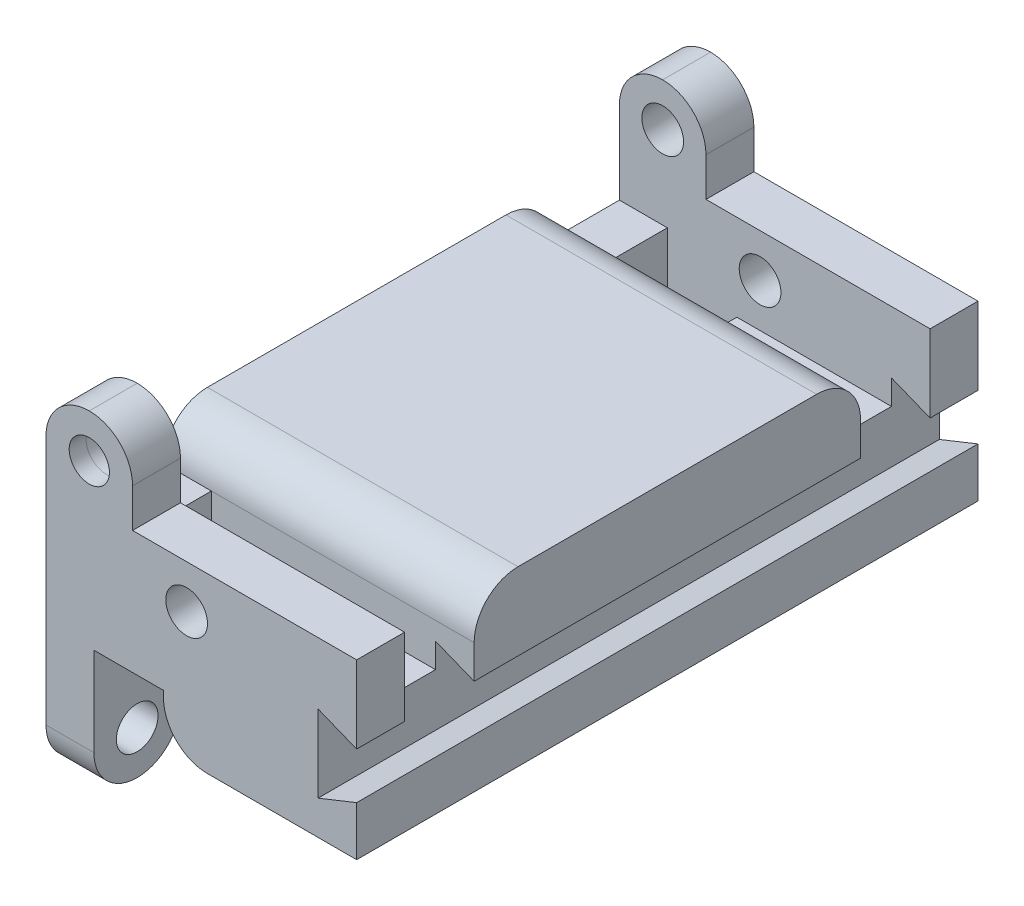
from build123d import *

# Parameters (mm, degrees)
ESBO_O1_R                  = 1.35
RESSALTO_EXTRUS_O1_DEPTH   = 2
ESBO_O3_W                  = 40.2
ESBO_O3_H                  = 2
RESSALTO_EXTRUS_O2_DEPTH   = 10.08
ESBO_O4_W                  = 3.1
ESBO_O4_H                  = 12.84
RESSALTO_EXTRUS_O3_DEPTH   = 34
CORTE_EXTRUS_O1_DEPTH      = 55.735280213
CORTE_EXTRUS_O1_DEPTH_BACK = 55.735280213
ESBO_O5_R                  = 1.35
ESBO_O7_W                  = 37.1
ESBO_O7_H                  = 3.24
CORTE_EXTRUS_O2_DEPTH      = 2
RESSALTO_EXTRUS_O5_START   = 2
ESBO_O12_R                 = 1.35
RESSALTO_EXTRUS_O5_DEPTH   = 2
ESBO_O18_W                 = 3.1
ESBO_O18_H                 = 3.24
RESSALTO_EXTRUS_O6_DEPTH   = 2
ESBO_O19_W                 = 3.1
ESBO_O19_H                 = 3.24
RESSALTO_EXTRUS_O7_DEPTH   = 2
ESBO_O21_R                 = 1.301764144
ESBO_O21_R_2               = 1.35
RESSALTO_EXTRUS_O8_DEPTH   = 1.1
RESSALTO_EXTRUS_O9_START   = 1.1
ESBO_O22_R                 = 1.35
RESSALTO_EXTRUS_O9_DEPTH   = 1.1
ESBO_O23_W                 = 3.1
ESBO_O23_H                 = 5.6
RESSALTO_EXTRUS_O10_DEPTH  = 5.85
CORTE_EXTRUS_O3_REACH      = 63.173
ESBO_O24_R                 = 1.35
ESBO_O25_W                 = 4.5
ESBO_O25_H                 = 3.1
CORTE_EXTRUS_O6_DEPTH      = 4.48
ESBO_O27_W                 = 3.1
ESBO_O27_H                 = 29
CORTE_EXTRUS_O7_DEPTH      = 4.48
ESBO_O28_W                 = 25
ESBO_O28_H                 = 40.2
CORTE_EXTRUS_O8_DEPTH      = 1.24
ESBO_O29_W                 = 25
ESBO_O29_H                 = 5.6
RESSALTO_EXTRUS_O11_DEPTH  = 34
ESBO_O31_W                 = 3.1
ESBO_O31_H                 = 25
RESSALTO_EXTRUS_O12_DEPTH  = 2.84
ESBO_O32_W                 = 25
ESBO_O32_H                 = 5.6
RESSALTO_EXTRUS_O13_DEPTH  = 34
FILETE1_R                  = 2.84
ESBO_O33_W                 = 5.6
ESBO_O33_H                 = 3.1
CORTE_EXTRUS_O9_DEPTH      = 0.55
ESBO_O35_W                 = 3.1
ESBO_O35_H                 = 5.6
CORTE_EXTRUS_O10_DEPTH     = 5.03
FILETE2_R                  = 2.8
DIVIDIR1_SURFACE_1_BACK    = 61.888
DIVIDIR1_SURFACE_1_DEPTH   = 123.776
DIVIDIR1_SURFACE_2_BACK    = 61.888
DIVIDIR1_SURFACE_2_DEPTH   = 123.776


with BuildPart() as part:
    # Esboço1 → Ressalto-extrusão1 (new body)
    with BuildSketch(Plane.XY):
        Polygon((0, 0), (5.6, 0), (5.6, -5.85), (34.6, -5.85), (34.6, 0), (40.2, 0), (40.2, -11.45), (0, -11.45), align=None)
        with Locations((2.8, -3.35)):
            Circle(ESBO_O1_R, mode=Mode.SUBTRACT)
        with Locations((37.4, -3.35)):
            Circle(ESBO_O1_R, mode=Mode.SUBTRACT)
        with Locations((31.1, -8.65)):
            Circle(ESBO_O1_R, mode=Mode.SUBTRACT)
        with Locations((9.1, -8.65)):
            Circle(ESBO_O1_R, mode=Mode.SUBTRACT)
    extrude(amount=RESSALTO_EXTRUS_O1_DEPTH)

    # Esboço3 → Ressalto-extrusão2 (add)
    with BuildSketch(Plane.XZ.offset(11.45)):
        with Locations((20.1, 1)):
            Rectangle(ESBO_O3_W, ESBO_O3_H)
    extrude(amount=RESSALTO_EXTRUS_O2_DEPTH)

    # Esboço4 → Ressalto-extrusão3 (add)
    with BuildSketch(Plane(origin=(0, 0, 0), x_dir=(-1, 0, 0), z_dir=(0, 0, -1))):
        with Locations((-38.65, -15.11)):
            Rectangle(ESBO_O4_W, ESBO_O4_H)
        with Locations((-1.55, -15.11)):
            Rectangle(ESBO_O4_W, ESBO_O4_H)
    extrude(amount=RESSALTO_EXTRUS_O3_DEPTH)

    # Esboço5 → Corte-extrusão1 (cut, two sides: drawn at the far end of the back side and taken through both)
    with BuildSketch(Plane.ZY.offset(-37.1).offset(-CORTE_EXTRUS_O1_DEPTH_BACK)):
        with Locations((-6, -14.25)):
            Circle(ESBO_O5_R)
        with Locations((-28, -14.25)):
            Circle(ESBO_O5_R)
    extrude(amount=CORTE_EXTRUS_O1_DEPTH + CORTE_EXTRUS_O1_DEPTH_BACK, mode=Mode.SUBTRACT)

    # Esboço7 → Corte-extrusão2 (cut)
    with BuildSketch(Plane(origin=(0, 0, 0), x_dir=(-1, 0, 0), z_dir=(0, 0, -1))):
        with Locations((-18.55, -19.91)):
            Rectangle(ESBO_O7_W, ESBO_O7_H)
    extrude(amount=-CORTE_EXTRUS_O2_DEPTH, mode=Mode.SUBTRACT)

    # Esboço12 → Ressalto-extrusão5 (add)
    with BuildSketch(Plane(origin=(0, 0, -34), x_dir=(-1, 0, 0), z_dir=(0, 0, -1)).offset(RESSALTO_EXTRUS_O5_START)):
        Polygon((-5.6, 0), (0, 0), (0, -18.29), (-40.2, -18.29), (-40.2, 0), (-34.6, 0), (-34.6, -5.85), (-5.6, -5.85), align=None)
        with Locations(Location((-31.1, -8.65, 0), (0, 0, 180))):
            Circle(ESBO_O12_R, mode=Mode.SUBTRACT)
        with Locations(Location((-9.1, -8.65, 0), (0, 0, 180))):
            Circle(ESBO_O12_R, mode=Mode.SUBTRACT)
        with Locations(Location((-2.8, -3.35, 0), (0, 0, 180))):
            Circle(ESBO_O12_R, mode=Mode.SUBTRACT)
        with Locations(Location((-37.4, -3.35, 0), (0, 0, 180))):
            Circle(ESBO_O12_R, mode=Mode.SUBTRACT)
    extrude(amount=-RESSALTO_EXTRUS_O5_DEPTH)

    # Esboço18 → Ressalto-extrusão6 (add)
    with BuildSketch(Plane.XY):
        with Locations((1.55, -19.91)):
            Rectangle(ESBO_O18_W, ESBO_O18_H)
    extrude(amount=RESSALTO_EXTRUS_O6_DEPTH)

    # Esboço19 → Ressalto-extrusão7 (add)
    with BuildSketch(Plane(origin=(0, 0, -34), x_dir=(-1, 0, 0), z_dir=(0, 0, -1))):
        with Locations((-1.55, -19.91)):
            Rectangle(ESBO_O19_W, ESBO_O19_H)
        with Locations((-38.65, -19.91)):
            Rectangle(ESBO_O19_W, ESBO_O19_H)
    extrude(amount=RESSALTO_EXTRUS_O7_DEPTH)

    # Esboço21 → Ressalto-extrusão8 (add)
    with BuildSketch(Plane.XY.offset(2)):
        Polygon((37.1, -21.53), (40.2, -21.53), (40.2, 0), (34.6, 0), (34.6, -5.85), (5.6, -5.85), (5.6, 0), (0, 0), (0, -21.53), (3.1, -21.53), (3.1, -18.29), (37.1, -18.29), align=None)
        with Locations((2.8, -3.35)):
            Circle(ESBO_O21_R, mode=Mode.SUBTRACT)
        with Locations((9.1, -8.65)):
            Circle(ESBO_O21_R_2, mode=Mode.SUBTRACT)
        with Locations((31.1, -8.65)):
            Circle(ESBO_O21_R_2, mode=Mode.SUBTRACT)
        with Locations((37.4, -3.35)):
            Circle(ESBO_O21_R_2, mode=Mode.SUBTRACT)
    extrude(amount=RESSALTO_EXTRUS_O8_DEPTH)

    # Esboço22 → Ressalto-extrusão9 (add)
    with BuildSketch(Plane(origin=(0, 0, -36), x_dir=(-1, 0, 0), z_dir=(0, 0, -1)).offset(RESSALTO_EXTRUS_O9_START)):
        Polygon((-5.6, 0), (0, 0), (0, -21.53), (-3.1, -21.53), (-3.1, -18.29), (-37.1, -18.29), (-37.1, -21.53), (-40.2, -21.53), (-40.2, 0), (-34.6, 0), (-34.6, -5.85), (-5.6, -5.85), align=None)
        with Locations(Location((-37.4, -3.35, 0), (0, 0, 180))):
            Circle(ESBO_O22_R, mode=Mode.SUBTRACT)
        with Locations(Location((-31.1, -8.65, 0), (0, 0, 180))):
            Circle(ESBO_O22_R, mode=Mode.SUBTRACT)
        with Locations(Location((-9.1, -8.65, 0), (0, 0, 180))):
            Circle(ESBO_O22_R, mode=Mode.SUBTRACT)
        with Locations(Location((-2.8, -3.35, 0), (0, 0, 180))):
            Circle(ESBO_O22_R, mode=Mode.SUBTRACT)
    extrude(amount=-RESSALTO_EXTRUS_O9_DEPTH)

    # Esboço23 → Ressalto-extrusão10 (add)
    with BuildSketch(Plane.XZ.offset(21.53)):
        with Locations((1.55, 0.3)):
            Rectangle(ESBO_O23_W, ESBO_O23_H)
        with Locations((1.55, -34.3)):
            Rectangle(ESBO_O23_W, ESBO_O23_H)
        with Locations((38.65, -34.3)):
            Rectangle(ESBO_O23_W, ESBO_O23_H)
        with Locations((38.65, 0.3)):
            Rectangle(ESBO_O23_W, ESBO_O23_H)
    extrude(amount=RESSALTO_EXTRUS_O10_DEPTH)

    # Corte-extrusão3: up to this face of the body (flat: up to its plane)
    corte_extrus_o3_end = Plane(part.part.faces().sort_by_distance((40.2, -15.177512698, -17))[0])
    # Esboço24 → Corte-extrusão3 (cut, up to the picked face)
    with BuildSketch(Plane.ZY, mode=Mode.PRIVATE) as corte_extrus_o3_sk1:
        with Locations(Location((-34.3, -19.55, 0), (0, 0, 270))):
            Circle(ESBO_O24_R)
    corte_extrus_o3_tool1 = split(extrude(corte_extrus_o3_sk1.sketch, amount=-CORTE_EXTRUS_O3_REACH, mode=Mode.PRIVATE), bisect_by=corte_extrus_o3_end, keep=Keep.BOTH, mode=Mode.PRIVATE)
    # Esboço24 → Corte-extrusão3 (cut, up to the picked face)
    with BuildSketch(Plane.ZY, mode=Mode.PRIVATE) as corte_extrus_o3_sk2:
        with Locations(Location((0.3, -19.55, 0), (0, 0, 270))):
            Circle(ESBO_O24_R)
    corte_extrus_o3_tool2 = split(extrude(corte_extrus_o3_sk2.sketch, amount=-CORTE_EXTRUS_O3_REACH, mode=Mode.PRIVATE), bisect_by=corte_extrus_o3_end, keep=Keep.BOTH, mode=Mode.PRIVATE)
    add(corte_extrus_o3_tool1.solids().sort_by(Axis((0, -19.55, -34.3), (1, 0, 0)))[0], mode=Mode.SUBTRACT)
    add(corte_extrus_o3_tool2.solids().sort_by(Axis((0, -19.55, 0.3), (1, 0, 0)))[0], mode=Mode.SUBTRACT)

    # Esboço25 → Corte-extrusão6 (cut)
    with BuildSketch(Plane.XZ.offset(18.29)):
        with Locations((5.35, -35.55)):
            Rectangle(ESBO_O25_W, ESBO_O25_H)
        with Locations((34.85, -35.55)):
            Rectangle(ESBO_O25_W, ESBO_O25_H)
        with Locations((34.85, 1.55)):
            Rectangle(ESBO_O25_W, ESBO_O25_H)
        with Locations((5.35, 1.55)):
            Rectangle(ESBO_O25_W, ESBO_O25_H)
    extrude(amount=-CORTE_EXTRUS_O6_DEPTH, mode=Mode.SUBTRACT)

    # Esboço27 → Corte-extrusão7 (cut)
    with BuildSketch(Plane.XZ.offset(21.53)):
        with Locations((1.55, -17)):
            Rectangle(ESBO_O27_W, ESBO_O27_H)
        with Locations((38.65, -17)):
            Rectangle(ESBO_O27_W, ESBO_O27_H)
    extrude(amount=-CORTE_EXTRUS_O7_DEPTH, mode=Mode.SUBTRACT)

    # Esboço28 → Corte-extrusão8 (cut)
    with BuildSketch(Plane.XZ.offset(18.29)):
        with Locations((20.1, -17)):
            Rectangle(ESBO_O28_W, ESBO_O28_H)
    extrude(amount=-CORTE_EXTRUS_O8_DEPTH, mode=Mode.SUBTRACT)

    # Esboço29 → Ressalto-extrusão11 (add)
    with BuildSketch(Plane.XY.offset(-34)):
        with Locations((20.1, -14.25)):
            Rectangle(ESBO_O29_W, ESBO_O29_H)
    extrude(amount=RESSALTO_EXTRUS_O11_DEPTH)

    # Esboço31 → Ressalto-extrusão12 (add)
    with BuildSketch(Plane(origin=(0, -8.69, 0), x_dir=(1, 0, 0), z_dir=(0, 1, 0))):
        with Locations((1.55, 17)):
            Rectangle(ESBO_O31_W, ESBO_O31_H)
        with Locations((38.65, 17)):
            Rectangle(ESBO_O31_W, ESBO_O31_H)
    extrude(amount=RESSALTO_EXTRUS_O12_DEPTH)

    # Esboço32 → Ressalto-extrusão13 (add)
    with BuildSketch(Plane.ZY.offset(-37.1)):
        with Locations((-17, -8.65)):
            Rectangle(ESBO_O32_W, ESBO_O32_H)
    extrude(amount=RESSALTO_EXTRUS_O13_DEPTH)

    # Filete1
    filete1_edges = [part.edges().sort_by_distance(p)[0] for p in [
        (32.6, -17.05, -17),
        (7.6, -17.05, -17),
        (20.1, -5.85, -29.5),
        (20.1, -5.85, -4.5),
    ]]
    fillet(filete1_edges, radius=FILETE1_R)

    # Esboço33 → Corte-extrusão9 (cut)
    with BuildSketch(Plane(origin=(0, 0, 0), x_dir=(1, 0, 0), z_dir=(0, 1, 0))):
        with Locations((2.8, 35.55)):
            Rectangle(ESBO_O33_W, ESBO_O33_H)
        with Locations((37.4, 35.55)):
            Rectangle(ESBO_O33_W, ESBO_O33_H)
        with Locations((37.4, -1.55)):
            Rectangle(ESBO_O33_W, ESBO_O33_H)
        with Locations((2.8, -1.55)):
            Rectangle(ESBO_O33_W, ESBO_O33_H)
    extrude(amount=-CORTE_EXTRUS_O9_DEPTH, mode=Mode.SUBTRACT)

    # Esboço35 → Corte-extrusão10 (cut)
    with BuildSketch(Plane.XZ.offset(27.38)):
        with Locations((1.55, 0.3)):
            Rectangle(ESBO_O35_W, ESBO_O35_H)
        with Locations((38.65, 0.3)):
            Rectangle(ESBO_O35_W, ESBO_O35_H)
        with Locations((38.65, -34.3)):
            Rectangle(ESBO_O35_W, ESBO_O35_H)
        with Locations((1.55, -34.3)):
            Rectangle(ESBO_O35_W, ESBO_O35_H)
    extrude(amount=-CORTE_EXTRUS_O10_DEPTH, mode=Mode.SUBTRACT)

    # Filete2
    filete2_edges = [part.edges().sort_by_distance(p)[0] for p in [
        (34.6, -0.55, 1.55),
        (40.2, -0.55, 1.55),
        (0, -0.55, 1.55),
        (5.6, -0.55, 1.55),
        (40.2, -0.55, -35.55),
        (34.6, -0.55, -35.55),
        (5.6, -0.55, -35.55),
        (0, -0.55, -35.55),
        (1.55, -22.35, -31.5),
        (1.55, -22.35, -37.1),
        (38.65, -22.35, -31.5),
        (38.65, -22.35, -37.1),
        (38.65, -22.35, 3.1),
        (38.65, -22.35, -2.5),
        (1.55, -22.35, -2.5),
        (1.55, -22.35, 3.1),
    ]]
    fillet(filete2_edges, radius=FILETE2_R - 0.0001)  # a hair under: the kernel refuses the full size


with BuildPart() as body_2:
    # Dividir1: the piece behind the surface
    add(part.part)
    # Dividir1 surface: a surface, the sketch's curves swept straight by 123.776 mm
    with BuildLine(Plane.XY.offset(3.1).offset(-DIVIDIR1_SURFACE_1_BACK), mode=Mode.PRIVATE) as dividir1_surface_1_path:
        Line((20.1, -0.55), (20.1, -10.85))
        Line((20.1, -10.85), (17.6, -9.85))
        Line((17.6, -9.85), (17.6, -14.85))
        Line((17.6, -14.85), (20.1, -13.85))
        Line((20.1, -13.85), (20.1, -22.35))
    dividir1_surface_1 = Shell.extrude(dividir1_surface_1_path.wire(), (0 * DIVIDIR1_SURFACE_1_DEPTH, 0 * DIVIDIR1_SURFACE_1_DEPTH, 1 * DIVIDIR1_SURFACE_1_DEPTH))
    split(bisect_by=dividir1_surface_1, keep=Keep.BOTTOM)


with BuildPart() as part_1:
    add(part.part)

    # Dividir1: split by a surface, the side it looks to stays
    # Dividir1 surface: a surface, the sketch's curves swept straight by 123.776 mm
    with BuildLine(Plane.XY.offset(3.1).offset(-DIVIDIR1_SURFACE_2_BACK), mode=Mode.PRIVATE) as dividir1_surface_2_path:
        Line((20.1, -0.55), (20.1, -10.85))
        Line((20.1, -10.85), (17.6, -9.85))
        Line((17.6, -9.85), (17.6, -14.85))
        Line((17.6, -14.85), (20.1, -13.85))
        Line((20.1, -13.85), (20.1, -22.35))
    dividir1_surface_2 = Shell.extrude(dividir1_surface_2_path.wire(), (0 * DIVIDIR1_SURFACE_2_DEPTH, 0 * DIVIDIR1_SURFACE_2_DEPTH, 1 * DIVIDIR1_SURFACE_2_DEPTH))
    split(bisect_by=dividir1_surface_2, keep=Keep.TOP)


solid = body_2.part
